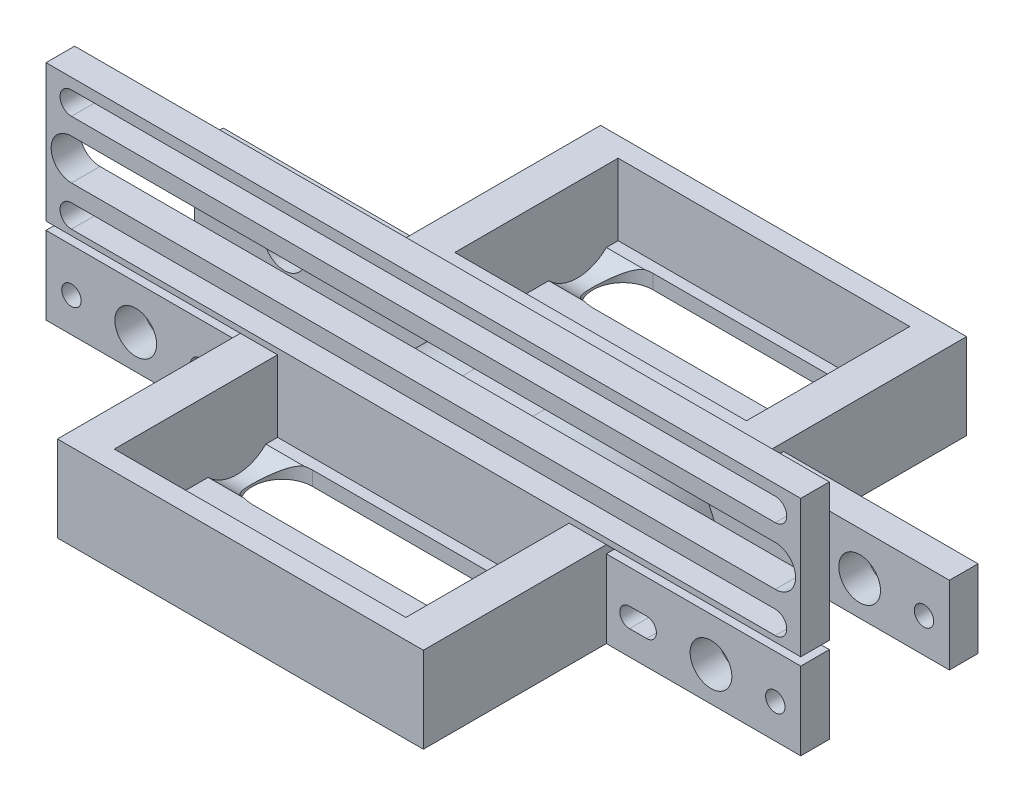
from build123d import *

# Parameters (mm, degrees)
SKETCH1_W                 = 51
SKETCH1_H                 = 28.56
TOTALHEIGHT_DEPTH         = 15
TOTALHEIGHT_2_DEPTH       = 15
SKETCH1_4_W               = 51
SKETCH1_4_H               = 21
MIDDLEFLOORHEIGHT_DEPTH   = 15
SKETCH1_3_W               = 51
SKETCH1_3_H               = 28.56
FLOORHEIGHT_DEPTH         = 2.5
DIPSFORBATTERY_REACH      = 134.749
SKETCH2_4_W               = 34
SKETCH2_4_H               = 1.4
SKETCH2_4_R               = 1.7
SKETCH2_4_R_2             = 3.65
MOUNTFORDRIVETRAIN_DEPTH  = 5
HOLESFORDRIVESHAFT_REACH  = 153.374
SKETCH2_R                 = 1.7
SKETCH2_R_2               = 3.65
FILLET1_R                 = 20
SLOTSFORPLASTICBARS_REACH = 153.374
SKETCH2_6_W               = 34
SKETCH2_6_H               = 1.4


with BuildPart() as part:
    # Sketch1 → TotalHeight (new body)
    with BuildSketch(Plane(origin=(0, 0, 0), x_dir=(1, 0, 0), z_dir=(0, 1, 0))):
        Polygon((34, 32), (34, 0), (98, 0), (98, 32), (132, 32), (132, 37), (0, 37), (0, 32), align=None)
        with Locations((66, 17.72)):
            Rectangle(SKETCH1_W, SKETCH1_H, mode=Mode.SUBTRACT)
    extrude(amount=TOTALHEIGHT_DEPTH)



with BuildPart() as body_2:
    # Sketch1 → TotalHeight 2 (new body)
    with BuildSketch(Plane(origin=(0, 0, 0), x_dir=(1, 0, 0), z_dir=(0, 1, 0))):
        Polygon((0, 63), (0, 58), (132, 58), (132, 63), (98, 63), (98, 95), (34, 95), (34, 63), align=None)
        with Locations((66, 77.28)):
            Rectangle(SKETCH1_W, SKETCH1_H, mode=Mode.SUBTRACT)
    extrude(amount=TOTALHEIGHT_2_DEPTH)


with BuildPart() as part_1:
    add(part.part)

    add(body_2.part)  # MiddleFloorHeight merges body 2
    # Sketch1<4> → MiddleFloorHeight (add)
    with BuildSketch(Plane(origin=(0, 0, 0), x_dir=(1, 0, 0), z_dir=(0, 1, 0))):
        with Locations((66, 47.5)):
            Rectangle(SKETCH1_4_W, SKETCH1_4_H)
    extrude(amount=MIDDLEFLOORHEIGHT_DEPTH)

    # Sketch1<3> → FloorHeight (add)
    # profile 1 of 2: a face of its own
    with BuildSketch(Plane(origin=(0, 0, 0), x_dir=(1, 0, 0), z_dir=(0, 1, 0))):
        with Locations((66, 77.28)):
            Rectangle(SKETCH1_3_W, SKETCH1_3_H)
        with BuildLine():
            ThreePointArc((83.5, 79.17), (88.75, 84.42), (83.5, 89.67))
            Line((83.5, 89.67), (48.5, 89.67))
            ThreePointArc((48.5, 89.67), (43.25, 84.42), (48.5, 79.17))
            Line((48.5, 79.17), (83.5, 79.17))
        make_face(mode=Mode.SUBTRACT)
        with BuildLine():
            Line((48.5, 75.39), (83.5, 75.39))
            ThreePointArc((83.5, 75.39), (88.75, 70.14), (83.5, 64.89))
            Line((83.5, 64.89), (48.5, 64.89))
            ThreePointArc((48.5, 64.89), (43.25, 70.14), (48.5, 75.39))
        make_face(mode=Mode.SUBTRACT)
    # profile 2 of 2: a face of its own
    with BuildSketch(Plane(origin=(0, 0, 0), x_dir=(1, 0, 0), z_dir=(0, 1, 0))):
        with Locations((66, 17.72)):
            Rectangle(SKETCH1_3_W, SKETCH1_3_H)
        with BuildLine():
            ThreePointArc((83.5, 19.61), (88.75, 24.86), (83.5, 30.11))
            Line((83.5, 30.11), (48.5, 30.11))
            ThreePointArc((48.5, 30.11), (43.25, 24.86), (48.5, 19.61))
            Line((48.5, 19.61), (83.5, 19.61))
        make_face(mode=Mode.SUBTRACT)
        with BuildLine():
            Line((48.5, 15.83), (83.5, 15.83))
            ThreePointArc((83.5, 15.83), (88.75, 10.58), (83.5, 5.33))
            Line((83.5, 5.33), (48.5, 5.33))
            ThreePointArc((48.5, 5.33), (43.25, 10.58), (48.5, 15.83))
        make_face(mode=Mode.SUBTRACT)
    extrude(amount=FLOORHEIGHT_DEPTH)

    # DipsForBattery: up to this face of the body (flat: up to its plane)
    dipsforbattery_end = Plane(part_1.part.faces().sort_by_distance((40.5, 8.75, -77.28))[0])
    # Sketch3 → DipsForBattery (cut, up to the picked face)
    with BuildSketch(Plane.ZY.offset(-91.5), mode=Mode.PRIVATE) as dipsforbattery_sk1:
        with BuildLine():
            ThreePointArc((-77.36, 7.5), (-87.163708918, 14.065055833), (-89.500833264, 2.5))
            Line((-89.500833264, 2.5), (-79.419166736, 2.5))
            ThreePointArc((-79.419166736, 2.5), (-77.894944167, 4.796291082), (-77.36, 7.5))
        make_face()
    dipsforbattery_tool1 = split(extrude(dipsforbattery_sk1.sketch, amount=DIPSFORBATTERY_REACH, mode=Mode.PRIVATE), bisect_by=dipsforbattery_end, keep=Keep.BOTH, mode=Mode.PRIVATE)
    # Sketch3 → DipsForBattery (cut, up to the picked face)
    with BuildSketch(Plane.ZY.offset(-91.5), mode=Mode.PRIVATE) as dipsforbattery_sk2:
        with BuildLine():
            Line((-79.419166736, 2.5), (-89.500833264, 2.5))
            ThreePointArc((-89.500833264, 2.5), (-84.46, 0.4), (-79.419166736, 2.5))
        make_face()
    dipsforbattery_tool2 = split(extrude(dipsforbattery_sk2.sketch, amount=DIPSFORBATTERY_REACH, mode=Mode.PRIVATE), bisect_by=dipsforbattery_end, keep=Keep.BOTH, mode=Mode.PRIVATE)
    # Sketch3 → DipsForBattery (cut, up to the picked face)
    with BuildSketch(Plane.ZY.offset(-91.5), mode=Mode.PRIVATE) as dipsforbattery_sk3:
        with BuildLine():
            ThreePointArc((-63, 7.5), (-72.803708918, 14.065055833), (-75.140833264, 2.5))
            Line((-75.140833264, 2.5), (-65.059166736, 2.5))
            ThreePointArc((-65.059166736, 2.5), (-63.534944167, 4.796291082), (-63, 7.5))
        make_face()
    dipsforbattery_tool3 = split(extrude(dipsforbattery_sk3.sketch, amount=DIPSFORBATTERY_REACH, mode=Mode.PRIVATE), bisect_by=dipsforbattery_end, keep=Keep.BOTH, mode=Mode.PRIVATE)
    # Sketch3 → DipsForBattery (cut, up to the picked face)
    with BuildSketch(Plane.ZY.offset(-91.5), mode=Mode.PRIVATE) as dipsforbattery_sk4:
        with BuildLine():
            Line((-65.059166736, 2.5), (-75.140833264, 2.5))
            ThreePointArc((-75.140833264, 2.5), (-70.1, 0.4), (-65.059166736, 2.5))
        make_face()
    dipsforbattery_tool4 = split(extrude(dipsforbattery_sk4.sketch, amount=DIPSFORBATTERY_REACH, mode=Mode.PRIVATE), bisect_by=dipsforbattery_end, keep=Keep.BOTH, mode=Mode.PRIVATE)
    # Sketch3 → DipsForBattery (cut, up to the picked face)
    with BuildSketch(Plane.ZY.offset(-91.5), mode=Mode.PRIVATE) as dipsforbattery_sk5:
        with BuildLine():
            ThreePointArc((-29.940833264, 2.5), (-24.9, 0.4), (-19.859166736, 2.5))
            Line((-19.859166736, 2.5), (-29.940833264, 2.5))
        make_face()
    dipsforbattery_tool5 = split(extrude(dipsforbattery_sk5.sketch, amount=DIPSFORBATTERY_REACH, mode=Mode.PRIVATE), bisect_by=dipsforbattery_end, keep=Keep.BOTH, mode=Mode.PRIVATE)
    # Sketch3 → DipsForBattery (cut, up to the picked face)
    with BuildSketch(Plane.ZY.offset(-91.5), mode=Mode.PRIVATE) as dipsforbattery_sk6:
        with BuildLine():
            Line((-29.940833264, 2.5), (-19.859166736, 2.5))
            ThreePointArc((-19.859166736, 2.5), (-18.334944167, 4.796291082), (-17.8, 7.5))
            ThreePointArc((-17.8, 7.5), (-27.603708918, 14.065055833), (-29.940833264, 2.5))
        make_face()
    dipsforbattery_tool6 = split(extrude(dipsforbattery_sk6.sketch, amount=DIPSFORBATTERY_REACH, mode=Mode.PRIVATE), bisect_by=dipsforbattery_end, keep=Keep.BOTH, mode=Mode.PRIVATE)
    # Sketch3 → DipsForBattery (cut, up to the picked face)
    with BuildSketch(Plane.ZY.offset(-91.5), mode=Mode.PRIVATE) as dipsforbattery_sk7:
        with BuildLine():
            ThreePointArc((-15.580833264, 2.5), (-10.54, 0.4), (-5.499166736, 2.5))
            Line((-5.499166736, 2.5), (-15.580833264, 2.5))
        make_face()
    dipsforbattery_tool7 = split(extrude(dipsforbattery_sk7.sketch, amount=DIPSFORBATTERY_REACH, mode=Mode.PRIVATE), bisect_by=dipsforbattery_end, keep=Keep.BOTH, mode=Mode.PRIVATE)
    # Sketch3 → DipsForBattery (cut, up to the picked face)
    with BuildSketch(Plane.ZY.offset(-91.5), mode=Mode.PRIVATE) as dipsforbattery_sk8:
        with BuildLine():
            Line((-15.580833264, 2.5), (-5.499166736, 2.5))
            ThreePointArc((-5.499166736, 2.5), (-3.974944167, 4.796291082), (-3.44, 7.5))
            ThreePointArc((-3.44, 7.5), (-13.243708918, 14.065055833), (-15.580833264, 2.5))
        make_face()
    dipsforbattery_tool8 = split(extrude(dipsforbattery_sk8.sketch, amount=DIPSFORBATTERY_REACH, mode=Mode.PRIVATE), bisect_by=dipsforbattery_end, keep=Keep.BOTH, mode=Mode.PRIVATE)
    add(dipsforbattery_tool1.solids().sort_by(Axis((91.5, 8.093926, -84.46), (-1, 0, 0)))[0], mode=Mode.SUBTRACT)
    add(dipsforbattery_tool2.solids().sort_by(Axis((91.5, 1.64835, -84.46), (-1, 0, 0)))[0], mode=Mode.SUBTRACT)
    add(dipsforbattery_tool3.solids().sort_by(Axis((91.5, 8.093926, -70.1), (-1, 0, 0)))[0], mode=Mode.SUBTRACT)
    add(dipsforbattery_tool4.solids().sort_by(Axis((91.5, 1.64835, -70.1), (-1, 0, 0)))[0], mode=Mode.SUBTRACT)
    add(dipsforbattery_tool5.solids().sort_by(Axis((91.5, 1.64835, -24.9), (-1, 0, 0)))[0], mode=Mode.SUBTRACT)
    add(dipsforbattery_tool6.solids().sort_by(Axis((91.5, 8.093926, -24.9), (-1, 0, 0)))[0], mode=Mode.SUBTRACT)
    add(dipsforbattery_tool7.solids().sort_by(Axis((91.5, 1.64835, -10.54), (-1, 0, 0)))[0], mode=Mode.SUBTRACT)
    add(dipsforbattery_tool8.solids().sort_by(Axis((91.5, 8.093926, -10.54), (-1, 0, 0)))[0], mode=Mode.SUBTRACT)

    # Sketch2<4> → MountForDriveTrain (add)
    # profile 1 of 4: a face of its own
    with BuildSketch(Plane.XY.offset(-32)):
        Polygon((0, 39), (0, 15), (34, 15), (98, 15), (132, 15), (132, 39), align=None)
        with BuildLine():
            ThreePointArc((4.45, 16), (2.45, 18), (4.45, 20))
            Line((4.45, 20), (127.55, 20))
            ThreePointArc((127.55, 20), (129.55, 18), (127.55, 16))
            Line((127.55, 16), (4.45, 16))
        make_face(mode=Mode.SUBTRACT)
        with BuildLine():
            ThreePointArc((4.45, 23), (0.9, 26.55), (4.45, 30.1))
            Line((4.45, 30.1), (127.55, 30.1))
            ThreePointArc((127.55, 30.1), (131.1, 26.55), (127.55, 23))
            Line((127.55, 23), (4.45, 23))
        make_face(mode=Mode.SUBTRACT)
        with BuildLine():
            ThreePointArc((4.45, 33.1), (2.45, 35.1), (4.45, 37.1))
            Line((4.45, 37.1), (127.55, 37.1))
            ThreePointArc((127.55, 37.1), (129.55, 35.1), (127.55, 33.1))
            Line((127.55, 33.1), (4.45, 33.1))
        make_face(mode=Mode.SUBTRACT)
    # profile 2 of 4: a face of its own
    with BuildSketch(Plane.XY.offset(-32)):
        with Locations((17, 14.3)):
            Rectangle(SKETCH2_4_W, SKETCH2_4_H)
    # profile 3 of 4: a face of its own
    with BuildSketch(Plane.XY.offset(-32)):
        Polygon((98, 15), (34, 15), (34, 13.6), (0, 13.6), (0, 0), (132, 0), (132, 13.6), (98, 13.6), align=None)
        with Locations((4.45, 6)):
            Circle(SKETCH2_4_R, mode=Mode.SUBTRACT)
        with Locations((15.7, 6)):
            Circle(SKETCH2_4_R_2, mode=Mode.SUBTRACT)
        with BuildLine():
            ThreePointArc((26.95, 4.3), (25.25, 6), (26.95, 7.7))
            Line((26.95, 7.7), (29.95, 7.7))
            ThreePointArc((29.95, 7.7), (31.65, 6), (29.95, 4.3))
            Line((29.95, 4.3), (26.95, 4.3))
        make_face(mode=Mode.SUBTRACT)
        with BuildLine():
            Line((102.05, 7.7), (105.05, 7.7))
            ThreePointArc((105.05, 7.7), (106.75, 6), (105.05, 4.3))
            Line((105.05, 4.3), (102.05, 4.3))
            ThreePointArc((102.05, 4.3), (100.35, 6), (102.05, 7.7))
        make_face(mode=Mode.SUBTRACT)
        with Locations((116.3, 6)):
            Circle(SKETCH2_4_R_2, mode=Mode.SUBTRACT)
        with Locations((127.55, 6)):
            Circle(SKETCH2_4_R, mode=Mode.SUBTRACT)
    # profile 4 of 4: a face of its own
    with BuildSketch(Plane.XY.offset(-32)):
        with Locations((115, 14.3)):
            Rectangle(SKETCH2_4_W, SKETCH2_4_H)
    extrude(amount=-MOUNTFORDRIVETRAIN_DEPTH)

    # HolesForDriveShaft: up to this face of the body (flat: up to its plane)
    holesfordriveshaft_end = Plane(part_1.part.faces().sort_by_distance((115, 7.5, -63))[0])
    # Sketch2 → HolesForDriveShaft (cut, up to the picked face)
    with BuildSketch(Plane.XY.offset(-32), mode=Mode.PRIVATE) as holesfordriveshaft_sk1:
        with Locations(Location((4.45, 6, 0), (0, 0, 180))):
            Circle(SKETCH2_R)
    holesfordriveshaft_tool1 = split(extrude(holesfordriveshaft_sk1.sketch, amount=-HOLESFORDRIVESHAFT_REACH, mode=Mode.PRIVATE), bisect_by=holesfordriveshaft_end, keep=Keep.BOTH, mode=Mode.PRIVATE)
    # Sketch2 → HolesForDriveShaft (cut, up to the picked face)
    with BuildSketch(Plane.XY.offset(-32), mode=Mode.PRIVATE) as holesfordriveshaft_sk2:
        with Locations(Location((15.7, 6, 0), (0, 0, 180))):
            Circle(SKETCH2_R_2)
    holesfordriveshaft_tool2 = split(extrude(holesfordriveshaft_sk2.sketch, amount=-HOLESFORDRIVESHAFT_REACH, mode=Mode.PRIVATE), bisect_by=holesfordriveshaft_end, keep=Keep.BOTH, mode=Mode.PRIVATE)
    # Sketch2 → HolesForDriveShaft (cut, up to the picked face)
    with BuildSketch(Plane.XY.offset(-32), mode=Mode.PRIVATE) as holesfordriveshaft_sk3:
        with BuildLine():
            Line((26.95, 4.3), (29.95, 4.3))
            ThreePointArc((29.95, 4.3), (31.65, 6), (29.95, 7.7))
            Line((29.95, 7.7), (26.95, 7.7))
            ThreePointArc((26.95, 7.7), (25.25, 6), (26.95, 4.3))
        make_face()
    holesfordriveshaft_tool3 = split(extrude(holesfordriveshaft_sk3.sketch, amount=-HOLESFORDRIVESHAFT_REACH, mode=Mode.PRIVATE), bisect_by=holesfordriveshaft_end, keep=Keep.BOTH, mode=Mode.PRIVATE)
    # Sketch2 → HolesForDriveShaft (cut, up to the picked face)
    with BuildSketch(Plane.XY.offset(-32), mode=Mode.PRIVATE) as holesfordriveshaft_sk4:
        with BuildLine():
            ThreePointArc((102.05, 4.3), (100.35, 6), (102.05, 7.7))
            Line((102.05, 7.7), (105.05, 7.7))
            ThreePointArc((105.05, 7.7), (106.75, 6), (105.05, 4.3))
            Line((105.05, 4.3), (102.05, 4.3))
        make_face()
    holesfordriveshaft_tool4 = split(extrude(holesfordriveshaft_sk4.sketch, amount=-HOLESFORDRIVESHAFT_REACH, mode=Mode.PRIVATE), bisect_by=holesfordriveshaft_end, keep=Keep.BOTH, mode=Mode.PRIVATE)
    # Sketch2 → HolesForDriveShaft (cut, up to the picked face)
    with BuildSketch(Plane.XY.offset(-32), mode=Mode.PRIVATE) as holesfordriveshaft_sk5:
        with Locations(Location((116.3, 6, 0), (0, 0, 180))):
            Circle(SKETCH2_R_2)
    holesfordriveshaft_tool5 = split(extrude(holesfordriveshaft_sk5.sketch, amount=-HOLESFORDRIVESHAFT_REACH, mode=Mode.PRIVATE), bisect_by=holesfordriveshaft_end, keep=Keep.BOTH, mode=Mode.PRIVATE)
    # Sketch2 → HolesForDriveShaft (cut, up to the picked face)
    with BuildSketch(Plane.XY.offset(-32), mode=Mode.PRIVATE) as holesfordriveshaft_sk6:
        with Locations(Location((127.55, 6, 0), (0, 0, 180))):
            Circle(SKETCH2_R)
    holesfordriveshaft_tool6 = split(extrude(holesfordriveshaft_sk6.sketch, amount=-HOLESFORDRIVESHAFT_REACH, mode=Mode.PRIVATE), bisect_by=holesfordriveshaft_end, keep=Keep.BOTH, mode=Mode.PRIVATE)
    add(holesfordriveshaft_tool1.solids().sort_by(Axis((4.45, 6, -32), (0, 0, -1)))[0], mode=Mode.SUBTRACT)
    add(holesfordriveshaft_tool2.solids().sort_by(Axis((15.7, 6, -32), (0, 0, -1)))[0], mode=Mode.SUBTRACT)
    add(holesfordriveshaft_tool3.solids().sort_by(Axis((28.45, 6, -32), (0, 0, -1)))[0], mode=Mode.SUBTRACT)
    add(holesfordriveshaft_tool4.solids().sort_by(Axis((103.55, 6, -32), (0, 0, -1)))[0], mode=Mode.SUBTRACT)
    add(holesfordriveshaft_tool5.solids().sort_by(Axis((116.3, 6, -32), (0, 0, -1)))[0], mode=Mode.SUBTRACT)
    add(holesfordriveshaft_tool6.solids().sort_by(Axis((127.55, 6, -32), (0, 0, -1)))[0], mode=Mode.SUBTRACT)

    # Fillet1
    # the kernel refuses this fillet: 20 mm, written as the material it takes off along each edge
    with BuildSketch(Plane(origin=(40.5, 15, -58), x_dir=(1, 0, 0), z_dir=(0, 0, 1)), Plane(origin=(91.5, 15, -37), x_dir=(-1, 0, 0), z_dir=(0, 0, -1))) as fillet1_piece_1:
        with BuildLine():
            CenterArc((19.364916731, -20), FILLET1_R, 90, 75.522487814)
            Line((0, -15), (-0.387298335, -14.9))
            ThreePointArc((-0.387298335, -14.9), (-0.4, -7.5), (-0.4, 0))
            Line((-0.4, 0), (0, 0.4))
            Line((0, 0.4), (19.364916731, 0.4))
            Line((19.364916731, 0.4), (19.364916731, 0))
        make_face()
    extrude(amount=21, mode=Mode.SUBTRACT)

    # SlotsForPlasticBars: up to this face of the body (flat: up to its plane)
    slotsforplasticbars_end = Plane(part_1.part.faces().sort_by_distance((33.628381916, 7.5, -63))[0])
    # Sketch2<6> → SlotsForPlasticBars (cut, up to the picked face)
    with BuildSketch(Plane.XY.offset(-32), mode=Mode.PRIVATE) as slotsforplasticbars_sk1:
        with Locations((115, 14.3)):
            Rectangle(SKETCH2_6_W, SKETCH2_6_H)
    slotsforplasticbars_tool1 = split(extrude(slotsforplasticbars_sk1.sketch, amount=-SLOTSFORPLASTICBARS_REACH, mode=Mode.PRIVATE), bisect_by=slotsforplasticbars_end, keep=Keep.BOTH, mode=Mode.PRIVATE)
    # Sketch2<6> → SlotsForPlasticBars (cut, up to the picked face)
    with BuildSketch(Plane.XY.offset(-32), mode=Mode.PRIVATE) as slotsforplasticbars_sk2:
        with Locations((17, 14.3)):
            Rectangle(SKETCH2_6_W, SKETCH2_6_H)
    slotsforplasticbars_tool2 = split(extrude(slotsforplasticbars_sk2.sketch, amount=-SLOTSFORPLASTICBARS_REACH, mode=Mode.PRIVATE), bisect_by=slotsforplasticbars_end, keep=Keep.BOTH, mode=Mode.PRIVATE)
    add(slotsforplasticbars_tool1.solids().sort_by(Axis((115, 14.3, -32), (0, 0, -1)))[0], mode=Mode.SUBTRACT)
    add(slotsforplasticbars_tool2.solids().sort_by(Axis((17, 14.3, -32), (0, 0, -1)))[0], mode=Mode.SUBTRACT)


solid = part_1.part
